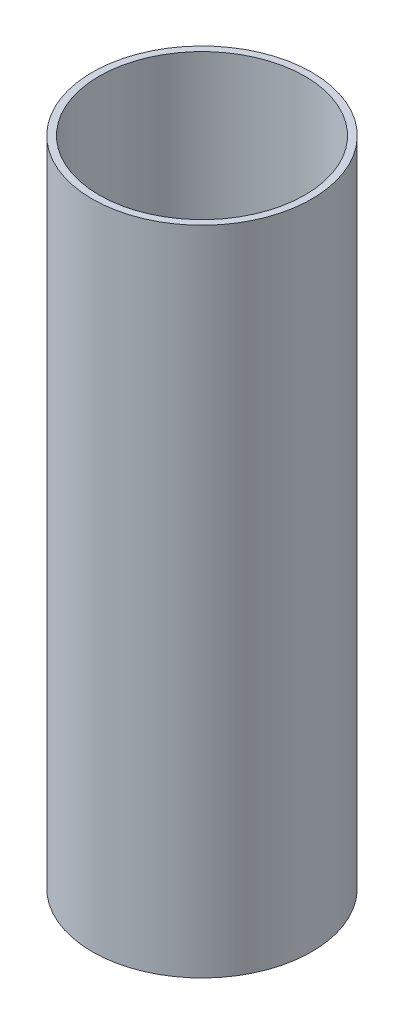
from build123d import *

# Parameters (mm, degrees)
SKETCH1_R           = 16
SKETCH1_R_2         = 15
BOSS_EXTRUDE1_DEPTH = 85
BOSS_EXTRUDE2_START = -10
SKETCH4_R           = 16
SKETCH4_R_2         = 15
BOSS_EXTRUDE2_DEPTH = 10


with BuildPart() as part:
    # Sketch1 → Boss-Extrude1 (new body)
    with BuildSketch(Plane(origin=(0, 0, 0), x_dir=(1, 0, 0), z_dir=(0, 1, 0))):
        Circle(SKETCH1_R)
        Circle(SKETCH1_R_2, mode=Mode.SUBTRACT)
    extrude(amount=BOSS_EXTRUDE1_DEPTH)

    # Sketch4 → Boss-Extrude2 (add)
    with BuildSketch(Plane(origin=(0, 0, 0), x_dir=(1, 0, 0), z_dir=(0, 1, 0)).offset(BOSS_EXTRUDE2_START)):
        Circle(SKETCH4_R)
        Circle(SKETCH4_R_2, mode=Mode.SUBTRACT)
    extrude(amount=BOSS_EXTRUDE2_DEPTH)


solid = part.part
